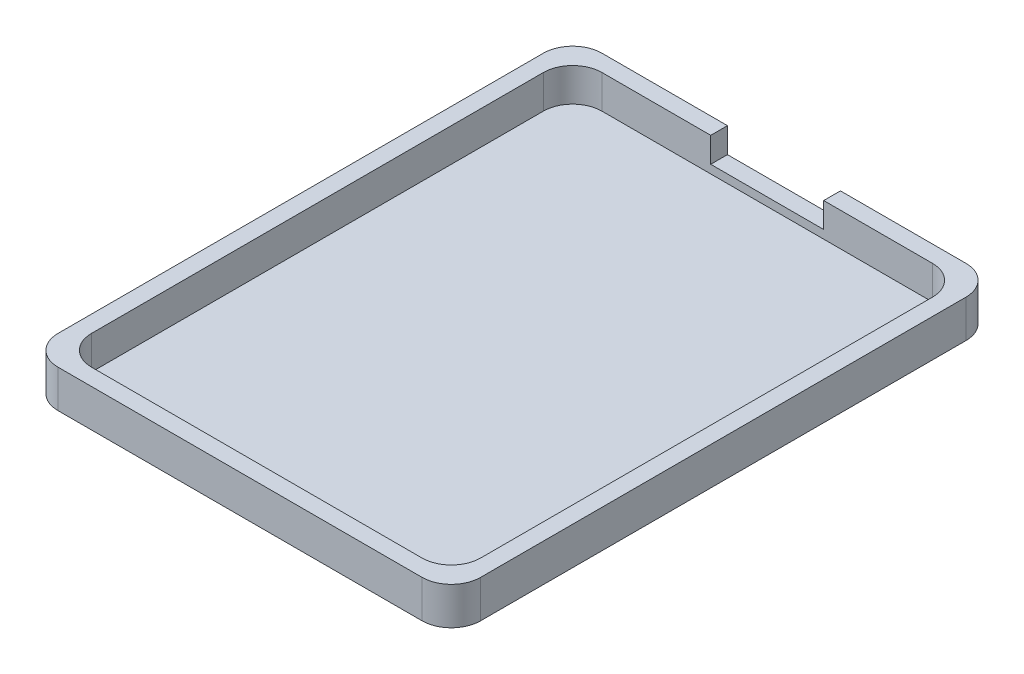
from build123d import *

# Parameters (mm, degrees)
BOSS_EXTRUDE1_DEPTH = 4.5
CUT_EXTRUDE1_DEPTH  = 4
SKETCH3_W           = 13.5
SKETCH3_H           = 6
CUT_EXTRUDE3_DEPTH  = 15


with BuildPart() as part:
    # Sketch1 → Boss-Extrude1 (new body)
    with BuildSketch(Plane(origin=(0, 0, 0), x_dir=(1, 0, 0), z_dir=(0, 1, 0))):
        with BuildLine():
            Line((3.5, 0), (47, 0))
            ThreePointArc((47, 0), (49.474873734, 1.025126266), (50.5, 3.5))
            Line((50.5, 3.5), (50.5, 61.5))
            ThreePointArc((50.5, 61.5), (49.474873734, 63.974873734), (47, 65))
            Line((47, 65), (3.5, 65))
            ThreePointArc((3.5, 65), (1.025126266, 63.974873734), (0, 61.5))
            Line((0, 61.5), (0, 3.5))
            ThreePointArc((0, 3.5), (1.025126266, 1.025126266), (3.5, 0))
        make_face()
    extrude(amount=BOSS_EXTRUDE1_DEPTH)

    # Sketch2 → Cut-Extrude1 (cut)
    with BuildSketch(Plane(origin=(0, 4.5, 0), x_dir=(1, 0, 0), z_dir=(0, 1, 0))):
        with BuildLine():
            Line((5.5, 2), (45, 2))
            ThreePointArc((45, 2), (47.474873734, 3.025126266), (48.5, 5.5))
            Line((48.5, 5.5), (48.5, 59.5))
            ThreePointArc((48.5, 59.5), (47.474873734, 61.974873734), (45, 63))
            Line((45, 63), (5.5, 63))
            ThreePointArc((5.5, 63), (3.025126266, 61.974873734), (2, 59.5))
            Line((2, 59.5), (2, 5.5))
            ThreePointArc((2, 5.5), (3.025126266, 3.025126266), (5.5, 2))
        make_face()
    extrude(amount=-CUT_EXTRUDE1_DEPTH, mode=Mode.SUBTRACT)

    # Sketch3 → Cut-Extrude3 (cut)
    with BuildSketch(Plane(origin=(0, 0, -65), x_dir=(-1, 0, 0), z_dir=(0, 0, -1))):
        with Locations((-25.25, 4.5)):
            Rectangle(SKETCH3_W, SKETCH3_H)
    extrude(amount=-CUT_EXTRUDE3_DEPTH, mode=Mode.SUBTRACT)


solid = part.part
